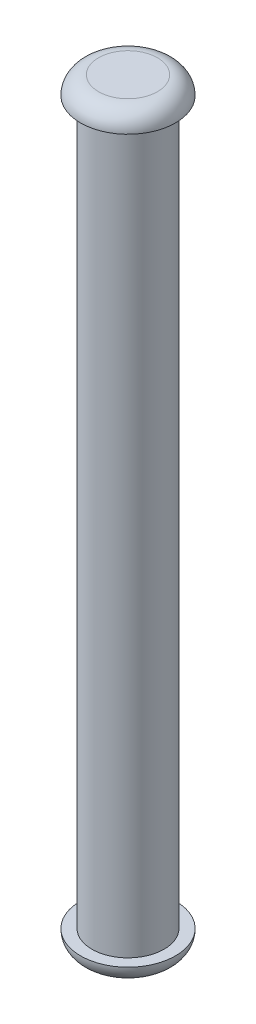
from build123d import *

# Parameters (mm, degrees)
SKETCH1_R           = 2
BOSS_EXTRUDE1_DEPTH = 40
SKETCH2_R           = 2.633085966
BOSS_EXTRUDE2_DEPTH = 1
FILLET1_R           = 1
BOSS_EXTRUDE3_START = 1
SKETCH3_R           = 2.633085966
BOSS_EXTRUDE3_DEPTH = 1
FILLET2_R           = 1


with BuildPart() as part:
    # Sketch1 → Boss-Extrude1 (new body)
    with BuildSketch(Plane(origin=(0, 0, 0), x_dir=(1, 0, 0), z_dir=(0, 1, 0))):
        with Locations(Location((0, 0, 0), (0, 0, 90))):
            Circle(SKETCH1_R)
    extrude(amount=BOSS_EXTRUDE1_DEPTH)

    # Sketch2 → Boss-Extrude2 (add)
    with BuildSketch(Plane(origin=(0, 40, 0), x_dir=(1, 0, 0), z_dir=(0, 1, 0))):
        Circle(SKETCH2_R)
    extrude(amount=BOSS_EXTRUDE2_DEPTH)

    # Fillet1
    fillet1_edges = [part.edges().sort_by_distance(p)[0] for p in [
        (-2.633085966, 41, 0),
    ]]
    fillet(fillet1_edges, radius=FILLET1_R - 0.0001)  # a hair under: the kernel refuses the full size

    # Sketch3 → Boss-Extrude3 (add)
    with BuildSketch(Plane.XZ.offset(BOSS_EXTRUDE3_START)):
        Circle(SKETCH3_R)
    extrude(amount=-BOSS_EXTRUDE3_DEPTH)

    # Fillet2
    fillet2_edges = [part.edges().sort_by_distance(p)[0] for p in [
        (-2.633085966, -1, 0),
    ]]
    fillet(fillet2_edges, radius=FILLET2_R - 0.0001)  # a hair under: the kernel refuses the full size


solid = part.part
